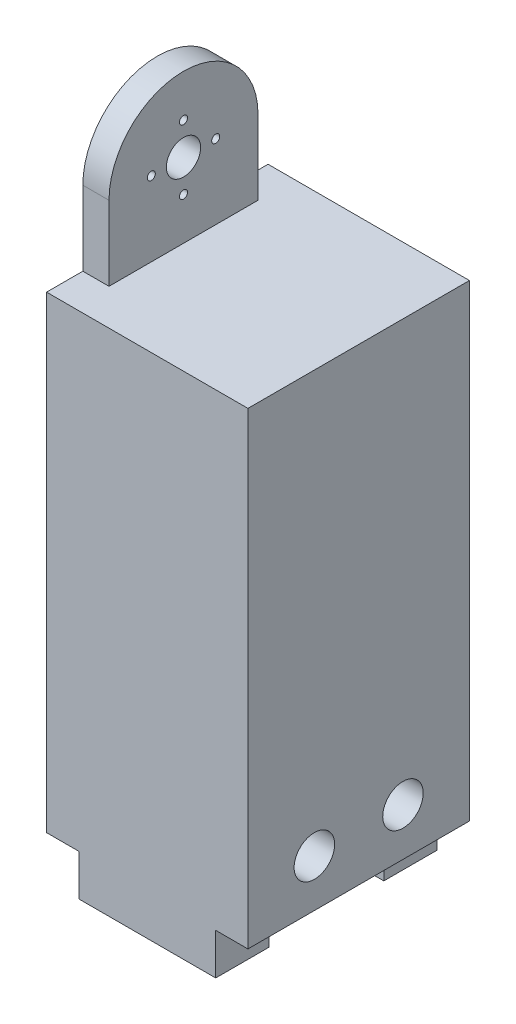
from build123d import *

# Parameters (mm, degrees)
SKETCH1_W               = 50
SKETCH1_H               = 150
BOSS_EXTRUDE1_DEPTH     = 55
CUT_EXTRUDE1_DEPTH      = 168.406690428
CUT_EXTRUDE1_DEPTH_BACK = 45
SKETCH2_R               = 10.25
SKETCH7_R               = 1
SKETCH7_R_2             = 4.25
CUT_EXTRUDE3_DEPTH      = 10
SKETCH8_W               = 55
SKETCH8_H               = 55
SKETCH8_R               = 10.25
BOSS_EXTRUDE2_DEPTH     = 50
CUT_EXTRUDE4_DEPTH      = 214.717102732
SKETCH11_W              = 34
SKETCH11_H              = 13.25
BOSS_EXTRUDE4_DEPTH     = 25
SKETCH13_W              = 55
SKETCH13_H              = 10
CUT_EXTRUDE5_DEPTH      = 8
SKETCH14_R              = 5.030159043
CUT_EXTRUDE6_DEPTH      = 8
SKETCH15_W              = 34
SKETCH15_H              = 0.25
BOSS_EXTRUDE5_DEPTH     = 13.25
CUT_EXTRUDE7_DEPTH      = 181.416185527
BOSS_EXTRUDE6_START     = 1.5
SKETCH19_R              = 10.25
SKETCH19_R_2            = 1
SKETCH19_R_3            = 4.25
BOSS_EXTRUDE6_DEPTH     = 1.5
CUT_EXTRUDE8_DEPTH      = 184.89467094


with BuildPart() as part:
    # Sketch1 → Boss-Extrude1 (new body)
    with BuildSketch(Plane.XY):
        with Locations((0, -75)):
            Rectangle(SKETCH1_W, SKETCH1_H)
    extrude(amount=-BOSS_EXTRUDE1_DEPTH)

    # Sketch2 → Cut-Extrude1 (cut, two sides: drawn at the far end of the back side and taken through both)
    with BuildSketch(Plane(origin=(25, 0, 0), x_dir=(0, 0, -1), z_dir=(1, 0, 0)).offset(-CUT_EXTRUDE1_DEPTH_BACK)):
        with Locations((27.5, -25)):
            Circle(SKETCH2_R)
    extrude(amount=CUT_EXTRUDE1_DEPTH + CUT_EXTRUDE1_DEPTH_BACK, mode=Mode.SUBTRACT)

    # Sketch7 → Cut-Extrude3 (cut)
    with BuildSketch(Plane(origin=(-20, 0, 0), x_dir=(0, 0, -1), z_dir=(1, 0, 0))):
        with Locations((27.5, -17)):
            Circle(SKETCH7_R)
        with Locations((27.5, -25)):
            Circle(SKETCH7_R_2)
        with Locations((35.5, -25)):
            Circle(SKETCH7_R)
        with Locations((19.5, -25)):
            Circle(SKETCH7_R)
        with Locations((27.5, -33)):
            Circle(SKETCH7_R)
    extrude(amount=-CUT_EXTRUDE3_DEPTH, mode=Mode.SUBTRACT)

    # Sketch8 → Boss-Extrude2 (add)
    with BuildSketch(Plane(origin=(25, 0, 0), x_dir=(0, 0, -1), z_dir=(1, 0, 0))):
        with Locations((27.5, -177.5)):
            Rectangle(SKETCH8_W, SKETCH8_H)
        with Locations((27.5, -180)):
            Circle(SKETCH8_R, mode=Mode.SUBTRACT)
    extrude(amount=-BOSS_EXTRUDE2_DEPTH)

    # Sketch10 → Cut-Extrude4 (cut, through all)
    with BuildSketch(Plane.XY):
        Polygon((25, -205), (25, -169.75), (17, -169.75), (17, -144.75), (-17, -144.75), (-17, -169.75), (-25, -169.75), (-25, -205), align=None)
    extrude(amount=-CUT_EXTRUDE4_DEPTH, mode=Mode.SUBTRACT)

    # Sketch11 → Boss-Extrude4 (add)
    with BuildSketch(Plane.XZ.offset(144.75)):
        with Locations((0, -6.625)):
            Rectangle(SKETCH11_W, SKETCH11_H)
        with Locations((0, -48.375)):
            Rectangle(SKETCH11_W, SKETCH11_H)
    extrude(amount=BOSS_EXTRUDE4_DEPTH)

    # Sketch13 → Cut-Extrude5 (cut)
    with BuildSketch(Plane(origin=(25, 0, 0), x_dir=(0, 0, -1), z_dir=(1, 0, 0))):
        with Locations((27.5, -164.75)):
            Rectangle(SKETCH13_W, SKETCH13_H)
    cut_extrude5 = extrude(amount=-CUT_EXTRUDE5_DEPTH, mode=Mode.SUBTRACT)

    # Mirror2: Cut-Extrude5 across plane
    add(cut_extrude5.mirror(Plane(origin=(0, 0, 0), x_dir=(0, 0, 1), z_dir=(1, 0, 0))), mode=Mode.SUBTRACT)

    # Sketch14 → Cut-Extrude6 (cut)
    with BuildSketch(Plane(origin=(25, 0, 0), x_dir=(0, 0, -1), z_dir=(1, 0, 0))):
        with Locations((16.5, -148)):
            Circle(SKETCH14_R)
        with Locations((38.5, -148)):
            Circle(SKETCH14_R)
    cut_extrude6 = extrude(amount=-CUT_EXTRUDE6_DEPTH, mode=Mode.SUBTRACT)

    # Mirror3: Cut-Extrude6 across plane
    add(cut_extrude6.mirror(Plane(origin=(0, 0, 0), x_dir=(0, 0, 1), z_dir=(1, 0, 0))), mode=Mode.SUBTRACT)

    # Sketch15 → Boss-Extrude5 (add)
    with BuildSketch(Plane.XY):
        with Locations((0, -169.875)):
            Rectangle(SKETCH15_W, SKETCH15_H)
    boss_extrude5 = extrude(amount=-BOSS_EXTRUDE5_DEPTH)

    # Mirror4: Boss-Extrude5 across plane
    add(boss_extrude5.mirror(Plane.XY.offset(-27.5)))

    # Sketch16 → Cut-Extrude7 (cut, through all)
    with BuildSketch(Plane.XY):
        Polygon((-18.5, 0), (-18.5, -14.75), (-18.5, -35.25), (-18.5, -43.5), (25, -43.5), (25, 0), align=None)
    extrude(amount=-CUT_EXTRUDE7_DEPTH, mode=Mode.SUBTRACT)

    # Sketch19 → Boss-Extrude6 (add)
    with BuildSketch(Plane(origin=(-20, 0, 0), x_dir=(0, 0, -1), z_dir=(1, 0, 0)).offset(BOSS_EXTRUDE6_START)):
        with Locations((27.5, -25)):
            Circle(SKETCH19_R)
        with Locations((19.5, -25)):
            Circle(SKETCH19_R_2, mode=Mode.SUBTRACT)
        with Locations((27.5, -33)):
            Circle(SKETCH19_R_2, mode=Mode.SUBTRACT)
        with Locations((27.5, -25)):
            Circle(SKETCH19_R_3, mode=Mode.SUBTRACT)
        with Locations((27.5, -17)):
            Circle(SKETCH19_R_2, mode=Mode.SUBTRACT)
        with Locations((35.5, -25)):
            Circle(SKETCH19_R_2, mode=Mode.SUBTRACT)
    extrude(amount=-BOSS_EXTRUDE6_DEPTH)

    # Sketch20 → Cut-Extrude8 (cut, through all)
    with BuildSketch(Plane(origin=(-18.5, 0, 0), x_dir=(0, 0, -1), z_dir=(1, 0, 0))):
        with BuildLine():
            Line((9, -43.5), (9, -25))
            ThreePointArc((9, -25), (27.5, -6.5), (46, -25))
            Line((46, -25), (46, -43.5))
            Line((46, -43.5), (55, -43.5))
            Line((55, -43.5), (55, 0))
            Line((55, 0), (0, 0))
            Line((0, 0), (0, -43.5))
            Line((0, -43.5), (9, -43.5))
        make_face()
    extrude(amount=-CUT_EXTRUDE8_DEPTH, mode=Mode.SUBTRACT)


solid = part.part
